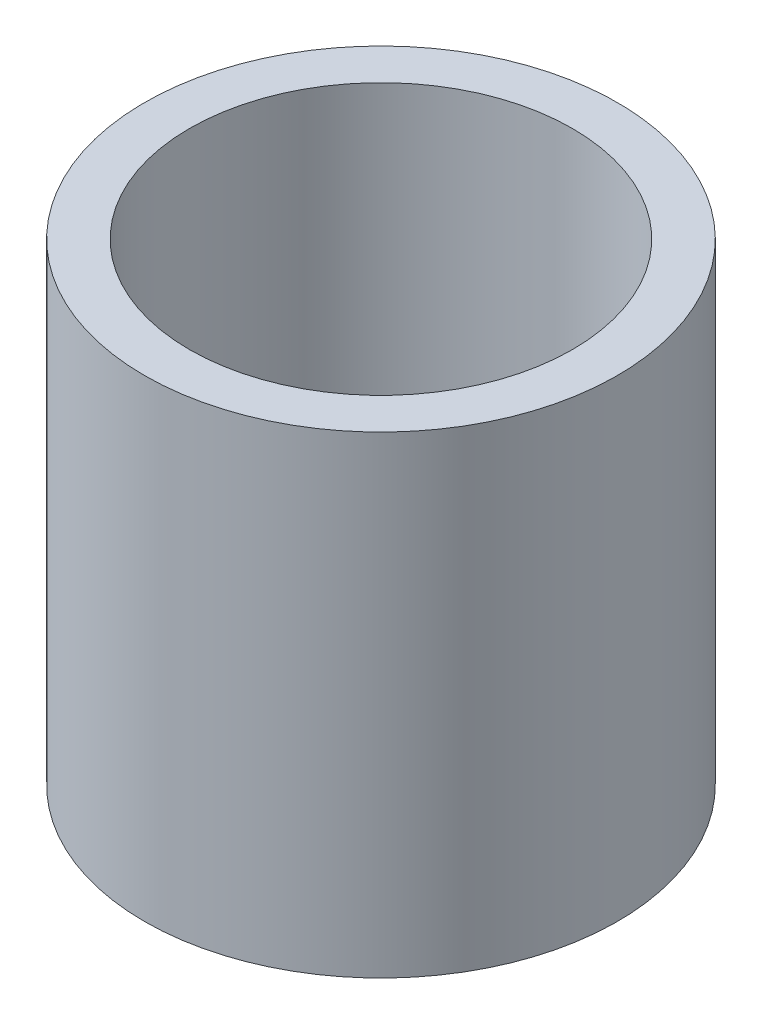
from build123d import *

# Parameters (mm, degrees)
SKETCH2_W = 9.652
SKETCH2_H = 101.6


with BuildPart() as part:
    # Sketch2 → Revolve1 (revolve)
    with BuildSketch(Plane.XY):
        with Locations((45.974, -50.8)):
            Rectangle(SKETCH2_W, SKETCH2_H)
    revolve(axis=Axis((0, 2.54, 0), (0, -1, 0)))


solid = part.part
